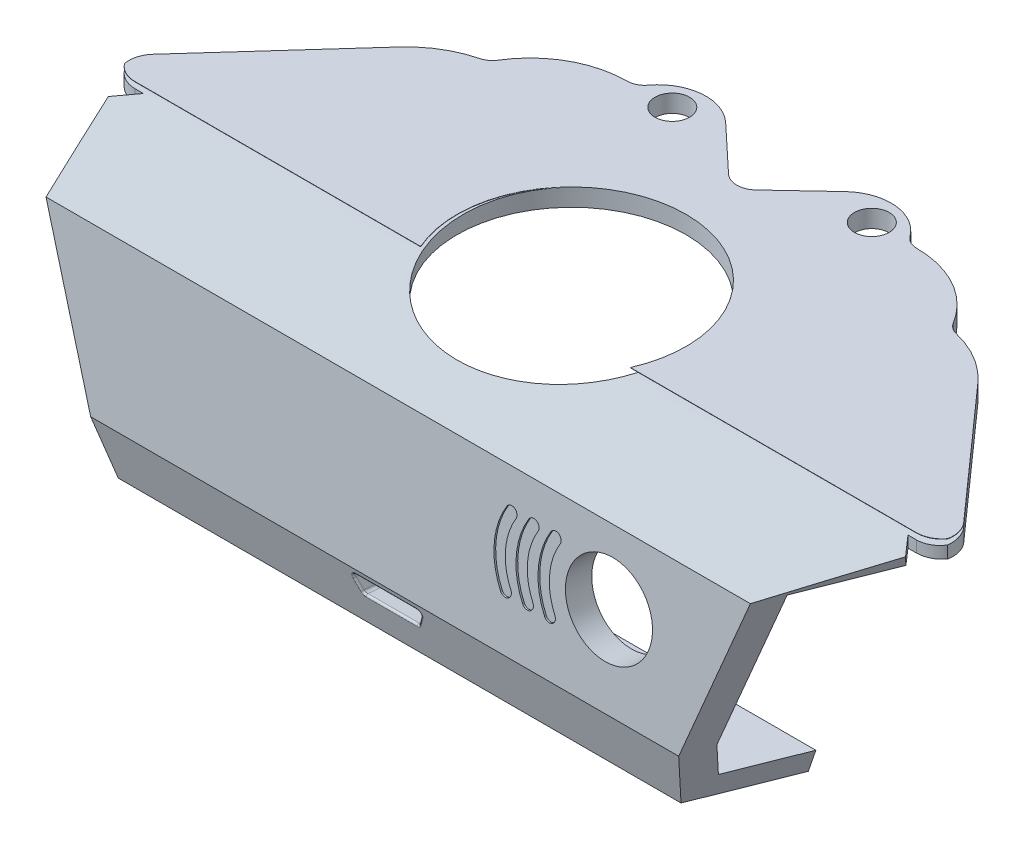
from build123d import *

# Parameters (mm, degrees)
THICKEN2_START          = -13
THICKEN2_DEPTH          = 1.27
THICKEN6_START          = -1
THICKEN6_DEPTH          = 1
THICKEN9_START          = -24.003
THICKEN9_DEPTH          = 48.006
THICKEN10_START         = -24.003
THICKEN10_DEPTH         = 48.006
BOSS_EXTRUDE2_OUTLINE_R = 1
BOSS_EXTRUDE2_DEPTH     = 1.016
FILLET3_R               = 1.5
CUT_EXTRUDE1_DEPTH      = 36.516130807
CUT_EXTRUDE1_DEPTH_BACK = 36.516130807
SKETCH10_R              = 6.6
CUT_EXTRUDE2_DEPTH      = 3.5
CUT_EXTRUDE3_REACH      = 37.516
SKETCH11_R              = 2.5
CUT_EXTRUDE4_DEPTH      = 0.1
CUT_EXTRUDE5_DEPTH      = 3
FILLET4_R               = 0.1
SKETCH14_R              = 0.75
BOSS_EXTRUDE3_DEPTH     = 0.8


# Read off the part's stored shape, not the designer's step: Thicken2, Thicken6, Thicken9, Thicken10, Boss-Extrude2
with BuildPart() as part:
    # Thicken2 outline → Thicken2 (new body)
    with BuildSketch(Plane(origin=(0, 0, 0), x_dir=(1, 0, 0), z_dir=(0, 1, 0)).offset(THICKEN2_START)):
        Polygon((-23.785678316, 5.25), (-24.003, 5), (-24.003, 0), (24.003, 0), (24.003, 5), (23.785678316, 5.25), align=None)
    extrude(amount=THICKEN2_DEPTH)



with BuildPart() as body_2:
    # Thicken6 outline → Thicken6 (new body)
    with BuildSketch(Plane(origin=(0, 0, 0), x_dir=(1, 0, 0), z_dir=(0, 1, 0)).offset(THICKEN6_START)):
        with BuildLine():
            Line((-16.023547901, 14.179309601), (-24.003, 5))
            Line((-24.003, 5), (-24.003, 0))
            Line((-24.003, 0), (24.003, 0))
            Line((24.003, 0), (24.003, 5))
            Line((24.003, 5), (16.023547901, 14.179309601))
            ThreePointArc((16.023547901, 14.179309601), (14.323466213, 15.448820811), (12.25, 15.899014457))
            Line((12.25, 15.899014457), (-12.25, 15.899014457))
            ThreePointArc((-12.25, 15.899014457), (-14.323466213, 15.448820811), (-16.023547901, 14.179309601))
        make_face()
    extrude(amount=THICKEN6_DEPTH)

    # Thicken9 outline → Thicken9 (add)
    with BuildSketch(Plane.YZ.offset(THICKEN9_START)):
        Polygon((0, 0), (-9.868304679, 0.863364788), (-10.001130031, -0.654835932), (-1, -1.442332769), (-1, 0), align=None)
    extrude(amount=THICKEN9_DEPTH)


with BuildPart() as part_1:
    add(part.part)

    add(body_2.part)  # Thicken10 merges body 2
    # Thicken10 outline → Thicken10 (add)
    with BuildSketch(Plane.YZ.offset(THICKEN10_START)):
        Polygon((-11.73, 0), (-11.73, -1.23073235), (-9.727787661, -0.678750291), (-10.001130031, -0.654835932), (-9.868304679, 0.863364788), (-13, 0), align=None)
    extrude(amount=THICKEN10_DEPTH)

    # Sketch7 → Cut-Loft2 section 0
    with BuildSketch(Plane(origin=(0, 0, 0), x_dir=(1, 0, 0), z_dir=(0, 1, 0))):
        with BuildLine():
            Line((20.32, -0.863364788), (24.008804966, 8.422190531))
            Line((24.008804966, 8.422190531), (26.32, 8.422190531))
            Line((26.32, 8.422190531), (26.32, -0.863364788))
            Line((26.32, -0.863364788), (20.32, -0.863364788))
        make_face()
    # Sketch8 → Cut-Loft2 section 1
    with BuildSketch(Plane.XZ.offset(13)):
        with BuildLine():
            Line((15.875, 0.863364788), (20.936436109, -11.877413162))
            Line((20.936436109, -11.877413162), (26.32, -11.877413162))
            Line((26.32, -11.877413162), (26.32, 0.863364788))
            Line((26.32, 0.863364788), (15.875, 0.863364788))
        make_face()
    cut_loft2 = loft(mode=Mode.SUBTRACT)

    # Mirror1: Cut-Loft2 across plane
    add(cut_loft2.mirror(Plane(origin=(0, 0, 0), x_dir=(0, 0, 1), z_dir=(1, 0, 0))), mode=Mode.SUBTRACT)

    # Boss-Extrude2 outline → Boss-Extrude2 (add)
    with BuildSketch(Plane(origin=(0, -1, 0), x_dir=(1, 0, 0), z_dir=(0, 1, 0))):
        with BuildLine():
            Line((23.499153152, 7.261702405), (24.008804966, 8.422190531))
            Line((24.008804966, 8.422190531), (16.761769975, 16.572292446))
            ThreePointArc((16.761769975, 16.572292446), (15.383384702, 17.684304835), (13.739556962, 18.343355573))
            ThreePointArc((13.739556962, 18.343355573), (13.383437193, 18.506537646), (13.117325298, 18.793999189))
            ThreePointArc((13.117325298, 18.793999189), (11.082844834, 20.750308539), (8.351850891, 21.463))
            ThreePointArc((8.351850891, 21.463), (7.901073784, 21.570363456), (7.547090653, 21.8694))
            ThreePointArc((7.547090653, 21.8694), (5.583733218, 22.975637128), (3.452669549, 22.242765623))
            Line((3.452669549, 22.242765623), (0.786738189, 19.742225285))
            ThreePointArc((0.786738189, 19.742225285), (0, 19.431), (-0.786738189, 19.742225285))
            Line((-0.786738189, 19.742225285), (-3.452669549, 22.242765623))
            ThreePointArc((-3.452669549, 22.242765623), (-5.583733218, 22.975637128), (-7.547090653, 21.8694))
            ThreePointArc((-7.547090653, 21.8694), (-7.901073784, 21.570363456), (-8.351850891, 21.463))
            ThreePointArc((-8.351850891, 21.463), (-11.082844834, 20.750308539), (-13.117325298, 18.793999189))
            ThreePointArc((-13.117325298, 18.793999189), (-13.383437193, 18.506537646), (-13.739556962, 18.343355573))
            ThreePointArc((-13.739556962, 18.343355573), (-15.315510917, 17.682786121), (-16.633347409, 16.594994851))
            Line((-16.633347409, 16.594994851), (-24.008804966, 8.422190531))
            Line((-24.008804966, 8.422190531), (-23.499153152, 7.261702405))
            Line((-23.499153152, 7.261702405), (23.499153152, 7.261702405))
        make_face()
        with Locations((-5.75, 21.463)):
            Circle(BOSS_EXTRUDE2_OUTLINE_R, mode=Mode.SUBTRACT)
        with Locations((5.75, 21.463)):
            Circle(BOSS_EXTRUDE2_OUTLINE_R, mode=Mode.SUBTRACT)
    extrude(amount=BOSS_EXTRUDE2_DEPTH)

    # Fillet3
    # the kernel refuses this fillet: 1.5 mm, written as the material it takes off along each edge
    with BuildSketch(Plane(origin=(24.008804966, -3.405286068, -8.422190531), x_dir=(-0.6644918787911877, 0, -0.7472954857488151), z_dir=(0, 1, 0))) as fillet3_piece_1:
        with BuildLine():
            CenterArc((FILLET3_R * 0.641409618106, FILLET3_R), FILLET3_R, 204.646994158, 65.353005842)
            Line((-FILLET3_R * 0.267484750474, FILLET3_R * 0.58297358985), (0, 0))
            Line((0, 0), (FILLET3_R * 0.641409618106, 0))
        make_face()
    extrude(amount=5.826572136, mode=Mode.SUBTRACT)
    with BuildSketch(Plane(origin=(23.499153152, -3.448809581, -7.261702405), x_dir=(0.4021019958771136, 0, -0.9155948803437259), z_dir=(0, 1, 0)), Plane(origin=(-23.499153152, -3.448809581, -7.261702405), x_dir=(1, 0, 0), z_dir=(0, 1, 0))) as fillet3_piece_2:
        with BuildLine():
            CenterArc((FILLET3_R * 0.653015888313, FILLET3_R), FILLET3_R, 203.70965032, 66.29034968)
            Line((-FILLET3_R * 0.26257899203, FILLET3_R * 0.597898004123), (0, 0))
            Line((0, 0), (FILLET3_R * 0.653015888313, 0))
        make_face()
    extrude(amount=5.913619162, mode=Mode.SUBTRACT)
    with BuildSketch(Plane(origin=(-24.008804966, -3.424775959, -8.422190531), x_dir=(0.402101995877114, 0, 0.9155948803437257), z_dir=(0, 1, 0))) as fillet3_piece_3:
        with BuildLine():
            CenterArc((FILLET3_R * 0.646606922335, FILLET3_R), FILLET3_R, 204.226023127, 65.773976873)
            Line((-FILLET3_R * 0.265326917133, FILLET3_R * 0.589662733312), (0, 0))
            Line((0, 0), (FILLET3_R * 0.646606922335, 0))
        make_face()
    extrude(amount=5.865551918, mode=Mode.SUBTRACT)

    # Sketch9 → Cut-Extrude1 (cut, two sides: drawn at the far end of the back side and taken through both)
    with BuildSketch(Plane(origin=(0, 0, 0), x_dir=(0, 0, -1), z_dir=(1, 0, 0)).offset(-CUT_EXTRUDE1_DEPTH_BACK)):
        with BuildLine():
            Line((14.484326684, 0), (0, 0))
            Line((0, 0), (-0.084476913, -0.965575535))
            add(Edge.make_bspline(
                [(14.484326684, 0), (9.617991424, -0.082537274), (4.758522398, -0.520302315), (-0.084476913, -0.965575535)],
                knots=[0.178298864, 0.178298864, 0.178298864, 0.178298864, 1, 1, 1, 1], degree=3))
        make_face()
    extrude(amount=CUT_EXTRUDE1_DEPTH + CUT_EXTRUDE1_DEPTH_BACK, mode=Mode.SUBTRACT)

    # Sketch10 → Cut-Extrude2 (cut)
    with BuildSketch(Plane(origin=(0, -1, 0), x_dir=(-1, 0, 0), z_dir=(0, -1, 0))):
        with Locations(Location((0.008086093, 9.915523087, 0), (0, 0, 90))):
            Circle(SKETCH10_R)
    extrude(amount=-CUT_EXTRUDE2_DEPTH, mode=Mode.SUBTRACT)

    # Sketch11 → Cut-Extrude3 (cut, up to next)
    with BuildSketch(Plane(origin=(0, 0, 0), x_dir=(1, 0, 0), z_dir=(0, 0.08715574274765839, 0.9961946980917457)), mode=Mode.PRIVATE) as cut_extrude3_sk1:
        with Locations(Location((12.5, -5, 0), (0, 0, 270))):
            Circle(SKETCH11_R)
    cut_extrude3_tool1 = extrude(cut_extrude3_sk1.sketch, amount=-CUT_EXTRUDE3_REACH, mode=Mode.PRIVATE) & part_1.part
    add(cut_extrude3_tool1.solids().sort_by_distance((12.5, -4.980973, 0.435779))[0], mode=Mode.SUBTRACT)

    # Sketch12 → Cut-Extrude4 (cut)
    with BuildSketch(Plane(origin=(0, 0, 0), x_dir=(1, 0, 0), z_dir=(0, 0.08715574274765839, 0.9961946980917457))):
        with BuildLine():
            ThreePointArc((6.993862992, -6.7125), (6.874904736, -7.156458256), (6.43094648, -7.0375))
            ThreePointArc((6.43094648, -7.0375), (5.885, -5), (6.43094648, -2.9625))
            ThreePointArc((6.43094648, -2.9625), (6.874904736, -2.843541744), (6.993862992, -3.2875))
            ThreePointArc((6.993862992, -3.2875), (6.535, -5), (6.993862992, -6.7125))
        make_face()
        with BuildLine():
            ThreePointArc((8.263862992, -6.7125), (8.144904736, -7.156458256), (7.70094648, -7.0375))
            ThreePointArc((7.70094648, -7.0375), (7.155, -5), (7.70094648, -2.9625))
            ThreePointArc((7.70094648, -2.9625), (8.144904736, -2.843541744), (8.263862992, -3.2875))
            ThreePointArc((8.263862992, -3.2875), (7.805, -5), (8.263862992, -6.7125))
        make_face()
        with BuildLine():
            Line((8.425, -5), (9.075, -5))
            ThreePointArc((9.075, -5), (9.191704045, -4.113544771), (9.533862992, -3.2875))
            ThreePointArc((9.533862992, -3.2875), (9.414904736, -2.843541744), (8.97094648, -2.9625))
            ThreePointArc((8.97094648, -2.9625), (8.563852258, -3.945312391), (8.425, -5))
        make_face()
        with BuildLine():
            ThreePointArc((9.533862992, -6.7125), (9.191704045, -5.886455229), (9.075, -5))
            Line((9.075, -5), (8.425, -5))
            ThreePointArc((8.425, -5), (8.563852258, -6.054687609), (8.97094648, -7.0375))
            ThreePointArc((8.97094648, -7.0375), (9.414904736, -7.156458256), (9.533862992, -6.7125))
        make_face()
    extrude(amount=-CUT_EXTRUDE4_DEPTH, mode=Mode.SUBTRACT)

    # Sketch13 → Cut-Extrude5 (cut)
    with BuildSketch(Plane(origin=(0, 0, 0), x_dir=(1, 0, 0), z_dir=(0, 0.08715574274765839, 0.9961946980917457))):
        with BuildLine():
            Line((1.75, -10.2), (-1.75, -10.2))
            ThreePointArc((-1.75, -10.2), (-1.918678289, -10.292540078), (-1.931261557, -10.484523652))
            Line((-1.931261557, -10.484523652), (-1.651476963, -11.084523652))
            ThreePointArc((-1.651476963, -11.084523652), (-1.577675327, -11.168678289), (-1.470215405, -11.2))
            Line((-1.470215405, -11.2), (1.470215405, -11.2))
            ThreePointArc((1.470215405, -11.2), (1.577675327, -11.168678289), (1.651476963, -11.084523652))
            Line((1.651476963, -11.084523652), (1.931261557, -10.484523652))
            ThreePointArc((1.931261557, -10.484523652), (1.918678289, -10.292540078), (1.75, -10.2))
        make_face()
    extrude(amount=-CUT_EXTRUDE5_DEPTH, mode=Mode.SUBTRACT)

    # Fillet4
    fillet4_edges = [part_1.edges().sort_by_distance(p)[0] for p in [
        (1.79136926, -10.771980268, 0.614234013),
        (1.920846671, -10.269492969, 0.752762763),
        (0, -10.170721834, 0.77999259),
        (-1.920846671, -10.269492969, 0.752762763),
        (-1.79136926, -10.771980268, 0.614234013),
        (-1.579134596, -11.166167714, 0.505562023),
        (0, -11.199351611, 0.496413685),
        (1.579134596, -11.166167714, 0.505562023),
        (1.579134596, -11.307892814, -1.114363277),
        (0, -11.34107671, -1.123511615),
        (-1.579134596, -11.307892814, -1.114363277),
        (-1.79136926, -10.913705367, -1.005691288),
        (-1.920846671, -10.411218069, -0.867162537),
        (0, -10.312446933, -0.83993271),
        (1.920846671, -10.411218069, -0.867162537),
        (1.79136926, -10.913705367, -1.005691288),
    ]]
    fillet(fillet4_edges, radius=FILLET4_R)

    # Sketch14 → Boss-Extrude3 (add)
    with BuildSketch(Plane(origin=(0, -0.132825352, -1.51820072), x_dir=(-1, 0, 0), z_dir=(0, -0.08715574274765839, -0.9961946980917457))):
        with Locations(Location((-3, -3.370487114, 0), (0, 0, 270))):
            Circle(SKETCH14_R)
        with Locations(Location((3, -3.370487114, 0), (0, 0, 270))):
            Circle(SKETCH14_R)
    extrude(amount=BOSS_EXTRUDE3_DEPTH)


solid = part_1.part
